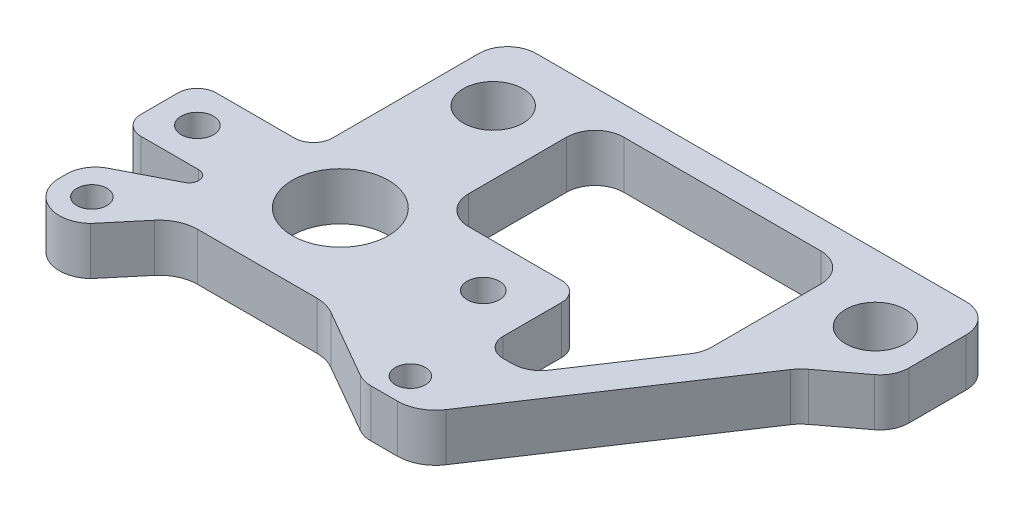
from build123d import *

# Parameters (mm, degrees)
SKETCH4_R           = 2
SKETCH4_R_2         = 2.1463
SKETCH4_R_3         = 6.3881
SKETCH4_R_4         = 3.96875
BOSS_EXTRUDE2_DEPTH = 6.35
FILLET1_R           = 5.08
FILLET7_R           = 3.81
FILLET9_R           = 5.08
FILLET10_R          = 1.27
FILLET11_R          = 3.81
FILLET12_R          = 2.54
FILLET13_R          = 3.81


with BuildPart() as part:
    # Sketch4 → Boss-Extrude2 (new body)
    with BuildSketch(Plane(origin=(0, 0, 0), x_dir=(1, 0, 0), z_dir=(0, 1, 0))):
        with BuildLine():
            Line((22.483900583, -18.4375), (28.735494078, -18.4375))
            Line((28.735494078, -18.4375), (48.985566477, 12.027918285))
            Line((48.985566477, 12.027918285), (54.680415238, 16.319294633))
            ThreePointArc((54.680415238, 16.319294633), (55.797199918, 17.662082259), (56.1975, 19.362095927))
            Line((56.1975, 19.362095927), (56.1975, 26.9875))
            ThreePointArc((56.1975, 26.9875), (55.081576836, 29.681576836), (52.3875, 30.7975))
            Line((52.3875, 30.7975), (-4.7625, 30.7975))
            ThreePointArc((-4.7625, 30.7975), (-7.456576836, 29.681576836), (-8.5725, 26.9875))
            Line((-8.5725, 26.9875), (-8.5725, 12.607500122))
            Line((-8.5725, 12.607500122), (-8.5725, 5))
            Line((-8.5725, 5), (-24.03032317, 5))
            Line((-24.03032317, 5), (-24.03032317, -5))
            Line((-24.03032317, -5), (-8.5725, -5))
            Line((-8.5725, -5), (-22.098, -11.933490986))
            Line((-22.098, -11.933490986), (-22.098, -15.24))
            ThreePointArc((-22.098, -15.24), (-19.494143335, -19.203185162), (-14.822948297, -18.386580561))
            Line((-14.822948297, -18.386580561), (-9.399713355, -11.933490986))
            Line((-9.399713355, -11.933490986), (10.16293305, -11.933490986))
            Line((10.16293305, -11.933490986), (20.583679925, -17.929811531))
            ThreePointArc((20.583679925, -17.929811531), (21.500464498, -18.308390309), (22.483900583, -18.4375))
        make_face()
        with Locations((-17.78, -15.24)):
            Circle(SKETCH4_R, mode=Mode.SUBTRACT)
        with Locations((-19, 0)):
            Circle(SKETCH4_R_2, mode=Mode.SUBTRACT)
        Circle(SKETCH4_R_3, mode=Mode.SUBTRACT)
        with Locations((24.012521227, -14.703599027)):
            Circle(SKETCH4_R, mode=Mode.SUBTRACT)
        with Locations((19, 0)):
            Circle(SKETCH4_R_2, mode=Mode.SUBTRACT)
        with Locations((-1.5875, 21.9075)):
            Circle(SKETCH4_R_4, mode=Mode.SUBTRACT)
        Polygon((6.882386285, 6.3725), (6.882386285, 26.9875), (40.692955064, 26.9875), (40.692955064, 7.472580753), (31.404651622, -6.501297657), (25.585775375, -6.501297657), (25.585775375, 6.3725), align=None, mode=Mode.SUBTRACT)
        with Locations((49.2125, 21.9075)):
            Circle(SKETCH4_R_4, mode=Mode.SUBTRACT)
    extrude(amount=-BOSS_EXTRUDE2_DEPTH)

    # Fillet1
    fillet1_edges = [part.edges().sort_by_distance(p)[0] for p in [
        (48.985566477, -3.175, -12.027918285),
        (28.735494078, -3.175, 18.4375),
    ]]
    fillet(fillet1_edges, radius=FILLET1_R)

    # Fillet7
    fillet7_edges = [part.edges().sort_by_distance(p)[0] for p in [
        (6.882386285, -3.175, -6.3725),
        (40.692955064, -3.175, -7.472580753),
        (40.692955064, -3.175, -26.9875),
        (6.882386285, -3.175, -26.9875),
    ]]
    fillet(fillet7_edges, radius=FILLET7_R)

    # Fillet9
    fillet9_edges = [part.edges().sort_by_distance(p)[0] for p in [
        (10.16293305, -3.175, 11.933490986),
        (-9.399713355, -3.175, 11.933490986),
    ]]
    fillet(fillet9_edges, radius=FILLET9_R)

    # Fillet10
    fillet10_edges = [part.edges().sort_by_distance(p)[0] for p in [
        (-8.5725, -3.175, 5),
    ]]
    fillet(fillet10_edges, radius=FILLET10_R)

    # Fillet11
    fillet11_edges = [part.edges().sort_by_distance(p)[0] for p in [
        (-22.098, -3.175, 11.933490986),
    ]]
    fillet(fillet11_edges, radius=FILLET11_R)

    # Fillet12
    fillet12_edges = [part.edges().sort_by_distance(p)[0] for p in [
        (25.585775375, -3.175, 6.501297657),
        (25.585775375, -3.175, -6.3725),
        (-8.5725, -3.175, -5),
        (-24.03032317, -3.175, -5),
        (-24.03032317, -3.175, 5),
    ]]
    fillet(fillet12_edges, radius=FILLET12_R)

    # Fillet13
    fillet13_edges = [part.edges().sort_by_distance(p)[0] for p in [
        (31.404651622, -3.175, 6.501297657),
    ]]
    fillet(fillet13_edges, radius=FILLET13_R)


solid = part.part
